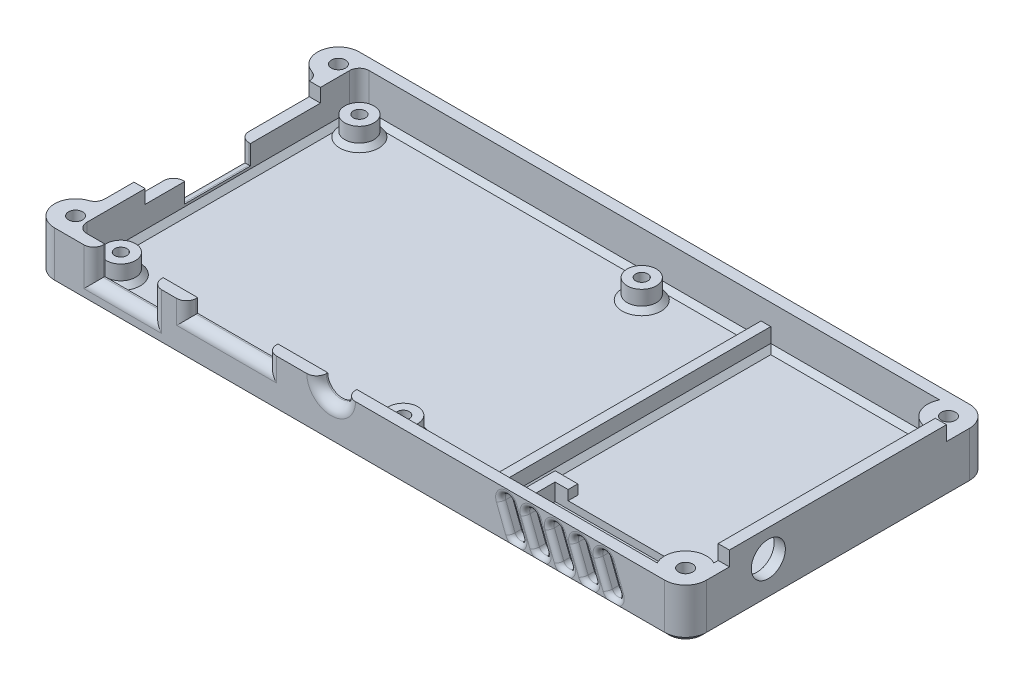
from build123d import *

# Parameters (mm, degrees)
SKETCH3_W                      = 129.6
SKETCH3_H                      = 62.6
SKETCH3_W_2                    = 125
SKETCH3_H_2                    = 58
BOSS_EXTRUDE1_DEPTH            = 10.3
SKETCH5_W                      = 125
SKETCH5_H                      = 58
BOSS_EXTRUDE2_DEPTH            = 2
SKETCH6_R                      = 3
BOSS_EXTRUDE3_DEPTH            = 4
F_2_5_2_5_DIAMETER_HOLE1_D     = 2.5
F_2_5_2_5_DIAMETER_HOLE1_DEPTH = 8
F_2_5_2_5_DIAMETER_HOLE1_TIP   = 0.751075774
SKETCH10_W                     = 2
SKETCH10_H                     = 58
BOSS_EXTRUDE4_DEPTH            = 4
CUT_EXTRUDE1_REACH             = 100.128
SKETCH11_R                     = 3
SKETCH11_W                     = 12
SKETCH11_H                     = 5.8
SKETCH11_W_2                   = 16.5
SKETCH11_H_2                   = 2.8
CUT_EXTRUDE2_REACH             = 136.484
SKETCH12_W                     = 13.5
SKETCH12_H                     = 6.8
SKETCH12_W_2                   = 36
SKETCH12_H_2                   = 2.8
FILLET6_R                      = 2
FILLET8_R                      = 2
CHAMFER1_SIZE                  = 1
FILLET9_R                      = 2
BOSS_EXTRUDE6_DEPTH            = 10.3
F_2_9_2_9_DIAMETER_HOLE2_D     = 2.9
F_2_9_2_9_DIAMETER_HOLE1_D     = 2.9
SKETCH24_R                     = 4.3
BOSS_EXTRUDE7_DEPTH            = 8.3
F_2_9_2_9_DIAMETER_HOLE5_D     = 2.9
F_2_9_2_9_DIAMETER_HOLE4_D     = 2.9
FILLET10_R                     = 4.3
FILLET18_R                     = 2
CHAMFER3_SIZE                  = 1
FILLET19_R                     = 2
FILLET20_R                     = 4.3
CHAMFER6_SIZE                  = 1
SKETCH29_W                     = 2.3
SKETCH29_H                     = 44.6
BOSS_EXTRUDE8_DEPTH            = 3
CUT_EXTRUDE3_REACH             = 163.516
SKETCH13_R                     = 3.5
SKETCH32_W                     = 30.1
SKETCH32_H                     = 10.2
CUT_EXTRUDE4_DEPTH             = 1.5
BOSS_EXTRUDE9_DEPTH            = 2
CUT_EXTRUDE5_REACH             = 103.795
FILLET21_R                     = 1
CHAMFER7_SIZE                  = 1


# Some blends are built 0.0001 mm under size
with BuildPart() as part:
    # Sketch3 → Boss-Extrude1 (new body)
    with BuildSketch(Plane(origin=(0, 0, 0), x_dir=(1, 0, 0), z_dir=(0, 1, 0))):
        with Locations((-10.061766162, 3.105993834)):
            Rectangle(SKETCH3_W, SKETCH3_H)
        with Locations((-10.061766162, 3.105993834)):
            Rectangle(SKETCH3_W_2, SKETCH3_H_2, mode=Mode.SUBTRACT)
    extrude(amount=BOSS_EXTRUDE1_DEPTH)

    # Sketch5 → Boss-Extrude2 (add)
    with BuildSketch(Plane(origin=(0, 0, 0), x_dir=(1, 0, 0), z_dir=(0, 1, 0))):
        with Locations((-10.061766162, 3.105993834)):
            Rectangle(SKETCH5_W, SKETCH5_H)
    extrude(amount=BOSS_EXTRUDE2_DEPTH)

    # Sketch6 → Boss-Extrude3 (add)
    with BuildSketch(Plane(origin=(0, 2, 0), x_dir=(1, 0, 0), z_dir=(0, 1, 0))):
        with Locations(Location((-68.061766162, 27.605993834, 0), (0, 0, 270))):
            Circle(SKETCH6_R)
        with Locations(Location((-68.061766162, -21.394006166, 0), (0, 0, 270))):
            Circle(SKETCH6_R)
        with Locations(Location((-10.061766162, -21.394006166, 0), (0, 0, 270))):
            Circle(SKETCH6_R)
        with Locations(Location((-10.061766162, 27.605993834, 0), (0, 0, 270))):
            Circle(SKETCH6_R)
    extrude(amount=BOSS_EXTRUDE3_DEPTH)

    # Ø2.5 (2.5) Diameter Hole1
    with Locations(Plane(origin=(0, 6, 0), x_dir=(1, 0, 0), z_dir=(0, 1, 0))):
        with Locations((-68.061766162, 27.605993834), (-10.061766162, 27.605993834), (-10.061766162, -21.394006166), (-68.061766162, -21.394006166)):
            Hole(F_2_5_2_5_DIAMETER_HOLE1_D / 2, depth=F_2_5_2_5_DIAMETER_HOLE1_DEPTH)
            with Locations((0, 0, -(F_2_5_2_5_DIAMETER_HOLE1_DEPTH + F_2_5_2_5_DIAMETER_HOLE1_TIP / 2))):  # 118° drill point
                Cone(0, F_2_5_2_5_DIAMETER_HOLE1_D / 2, F_2_5_2_5_DIAMETER_HOLE1_TIP, mode=Mode.SUBTRACT)

    # Sketch10 → Boss-Extrude4 (add)
    with BuildSketch(Plane(origin=(0, 2, 0), x_dir=(1, 0, 0), z_dir=(0, 1, 0))):
        with Locations((10.938233838, 3.105993834)):
            Rectangle(SKETCH10_W, SKETCH10_H)
    extrude(amount=BOSS_EXTRUDE4_DEPTH)

    # Sketch11 → Cut-Extrude1 (cut, up to next)
    with BuildSketch(Plane.XY.offset(28.194006166), mode=Mode.PRIVATE) as cut_extrude1_sk1:
        with Locations((-18.061766162, 10.3)):
            Circle(SKETCH11_R)
    cut_extrude1_tool1 = extrude(cut_extrude1_sk1.sketch, amount=-CUT_EXTRUDE1_REACH, mode=Mode.PRIVATE) & part.part
    # Sketch11 → Cut-Extrude1 (cut, up to next)
    with BuildSketch(Plane.XY.offset(28.194006166), mode=Mode.PRIVATE) as cut_extrude1_sk2:
        with Locations((-60.861766162, 7.4)):
            Rectangle(SKETCH11_W, SKETCH11_H)
    cut_extrude1_tool2 = extrude(cut_extrude1_sk2.sketch, amount=-CUT_EXTRUDE1_REACH, mode=Mode.PRIVATE) & part.part
    # Sketch11 → Cut-Extrude1 (cut, up to next)
    with BuildSketch(Plane.XY.offset(28.194006166), mode=Mode.PRIVATE) as cut_extrude1_sk3:
        with Locations((-39.527982648, 8.9)):
            Rectangle(SKETCH11_W_2, SKETCH11_H_2)
    cut_extrude1_tool3 = extrude(cut_extrude1_sk3.sketch, amount=-CUT_EXTRUDE1_REACH, mode=Mode.PRIVATE) & part.part
    add(cut_extrude1_tool1.solids().sort_by_distance((-18.061766, 10.3, 28.194006))[0], mode=Mode.SUBTRACT)
    add(cut_extrude1_tool2.solids().sort_by_distance((-60.861766, 7.4, 28.194006))[0], mode=Mode.SUBTRACT)
    add(cut_extrude1_tool3.solids().sort_by_distance((-39.527983, 8.9, 28.194006))[0], mode=Mode.SUBTRACT)

    # Sketch12 → Cut-Extrude2 (cut, up to next)
    with BuildSketch(Plane.ZY.offset(74.861766162), mode=Mode.PRIVATE) as cut_extrude2_sk1:
        with Locations((-2.982922372, 6.9)):
            Rectangle(SKETCH12_W, SKETCH12_H)
    cut_extrude2_tool1 = extrude(cut_extrude2_sk1.sketch, amount=-CUT_EXTRUDE2_REACH, mode=Mode.PRIVATE) & part.part
    # Sketch12 → Cut-Extrude2 (cut, up to next)
    with BuildSketch(Plane.ZY.offset(74.861766162), mode=Mode.PRIVATE) as cut_extrude2_sk2:
        with Locations((-6.105993834, 8.9)):
            Rectangle(SKETCH12_W_2, SKETCH12_H_2)
    cut_extrude2_tool2 = extrude(cut_extrude2_sk2.sketch, amount=-CUT_EXTRUDE2_REACH, mode=Mode.PRIVATE) & part.part
    add(cut_extrude2_tool1.solids().sort_by_distance((-74.861766, 6.9, -2.982922))[0], mode=Mode.SUBTRACT)
    add(cut_extrude2_tool2.solids().sort_by_distance((-74.861766, 8.9, -6.105994))[0], mode=Mode.SUBTRACT)

    # Fillet6
    fillet6_edges = [part.edges().sort_by_distance(p)[0] for p in [
        (52.438233838, 6.15, -32.105993834),
    ]]
    fillet(fillet6_edges, radius=FILLET6_R)

    # Fillet8
    fillet8_edges = [part.edges().sort_by_distance(p)[0] for p in [
        (-72.561766162, 6.15, -32.105993834),
        (-72.561766162, 6.15, 25.894006166),
    ]]
    fillet(fillet8_edges, radius=FILLET8_R)

    # Chamfer1
    chamfer1_edges = [part.edges().sort_by_distance(p)[0] for p in [
        (-68.061766162, 2, -30.605993834),
        (-68.061766162, 2, 18.394006166),
        (-10.061766162, 2, 18.394006166),
        (-10.061766162, 2, -30.605993834),
    ]]
    chamfer(chamfer1_edges, length=CHAMFER1_SIZE)

    # Fillet9
    fillet9_edges = [part.edges().sort_by_distance(p)[0] for p in [
        (-60.861766162, 4.5, 28.194006166),
        (-54.861766162, 7.4, 28.194006166),
        (-47.777982648, 8.9, 28.194006166),
        (-39.527982648, 7.5, 28.194006166),
        (-31.277982648, 8.9, 28.194006166),
        (-18.061766162, 7.3, 28.194006166),
        (-74.861766162, 5.5, -9.732922372),
        (-74.861766162, 3.5, -2.982922372),
        (-74.861766162, 5.5, 3.767077628),
    ]]
    fillet(fillet9_edges, radius=FILLET9_R)

    # Sketch17 → Boss-Extrude6 (add)
    with BuildSketch(Plane(origin=(0, 0, 0), x_dir=(1, 0, 0), z_dir=(0, 1, 0))):
        with BuildLine():
            Line((-74.861766162, 34.405993834), (-74.861766162, 25.805993834))
            ThreePointArc((-74.861766162, 25.805993834), (-79.161766162, 30.105993834), (-74.861766162, 34.405993834))
        make_face()
        with BuildLine():
            Line((-74.861766162, -19.594006166), (-74.861766162, -28.194006166))
            ThreePointArc((-74.861766162, -28.194006166), (-79.161766162, -23.894006166), (-74.861766162, -19.594006166))
        make_face()
    extrude(amount=BOSS_EXTRUDE6_DEPTH)

    # Ø2.9 (2.9) Diameter Hole2 (through all)
    with Locations(Plane(origin=(0, 10.3, 0), x_dir=(1, 0, 0), z_dir=(0, 1, 0))):
        with Locations((-74.861766162, 30.105993834)):
            Hole(F_2_9_2_9_DIAMETER_HOLE2_D / 2)

    # Ø2.9 (2.9) Diameter Hole1 (through all)
    with Locations(Plane(origin=(0, 10.3, 0), x_dir=(1, 0, 0), z_dir=(0, 1, 0))):
        with Locations((-74.861766162, -23.894006166)):
            Hole(F_2_9_2_9_DIAMETER_HOLE1_D / 2)

    # Sketch24 → Boss-Extrude7 (add)
    with BuildSketch(Plane(origin=(0, 2, 0), x_dir=(1, 0, 0), z_dir=(0, 1, 0))):
        with Locations((50.438233838, -23.894006166)):
            Circle(SKETCH24_R)
        with Locations((50.438233838, 30.105993834)):
            Circle(SKETCH24_R)
    extrude(amount=BOSS_EXTRUDE7_DEPTH)

    # Ø2.9 (2.9) Diameter Hole5 (through all)
    with Locations(Plane(origin=(0, 10.3, 0), x_dir=(1, 0, 0), z_dir=(0, 1, 0))):
        with Locations((50.438233838, -23.894006166)):
            Hole(F_2_9_2_9_DIAMETER_HOLE5_D / 2)

    # Ø2.9 (2.9) Diameter Hole4 (through all)
    with Locations(Plane(origin=(0, 10.3, 0), x_dir=(1, 0, 0), z_dir=(0, 1, 0))):
        with Locations((50.438233838, 30.105993834)):
            Hole(F_2_9_2_9_DIAMETER_HOLE4_D / 2)

    # Fillet10
    fillet10_edges = [part.edges().sort_by_distance(p)[0] for p in [
        (54.738233838, 5.15, -34.405993834),
    ]]
    fillet(fillet10_edges, radius=FILLET10_R - 0.0001)  # a hair under: the kernel refuses the full size

    # Fillet18
    fillet18_edges = [part.edges().sort_by_distance(p)[0] for p in [
        (-74.861766162, 5.15, -25.805993834),
        (-74.861766162, 5.15, 19.594006166),
    ]]
    fillet(fillet18_edges, radius=FILLET18_R)

    # Chamfer3
    chamfer3_edges = [part.edges().sort_by_distance(p)[0] for p in [
        (-79.105793795, 0, -30.797535193),
        (-12.211716162, 0, -34.405993834),
        (53.478822286, 0, -33.146582283),
        (-79.105793795, 0, 24.585547524),
        (-74.861766162, 0, -3.105993834),
        (-75.2385223, 0, 19.088261462),
        (-75.2385223, 0, -25.300249131),
        (54.738233838, 0, -0.956043834),
        (-10.061766162, 0, 28.194006166),
    ]]
    chamfer(chamfer3_edges, length=CHAMFER3_SIZE)

    # Fillet19
    fillet19_edges = [part.edges().sort_by_distance(p)[0] for p in [
        (-66.861766162, 6.4, 28.194006166),
    ]]
    fillet(fillet19_edges, radius=FILLET19_R)

    # Fillet20
    # the kernel refuses this fillet: 4.3 mm, written as the material it takes off along each edge
    with BuildSketch(Plane(origin=(54.738233838, -9.75, 28.194006166), x_dir=(-1, 0, 0), z_dir=(0, 1, 0))) as fillet20_piece_1:
        with BuildLine():
            CenterArc((FILLET20_R, -FILLET20_R), FILLET20_R, 90, 90)
            Line((0, -FILLET20_R), (0, 0))
            Line((0, 0), (FILLET20_R, 0))
        make_face()
    extrude(amount=30.8, mode=Mode.SUBTRACT)

    # Chamfer5
    # the kernel refuses this chamfer: 1 mm, written as the material it adds along each edge
    with BuildSketch(Plane(origin=(-72.561766162, 2, 23.894006166), x_dir=(-0.027495876610568366, 0.9996219169112972, 0), z_dir=(0, 0, -1))) as chamfer5_piece_1:
        with BuildLine():
            Line((1.028673195, 0), (-0.056547155, 1.027117794))
            Line((-0.056547155, 1.027117794), (-0.076539593, 1.026567876))
            ThreePointArc((-0.076539593, 1.026567876), (-0.034129227, 0.51339783), (-0.019992438, -0.000549918))
            Line((-0.019992438, -0.000549918), (0.000549918, -0.019992438))
            ThreePointArc((0.000549918, -0.019992438), (0.514497665, -0.00585565), (1.029223113, -0.019992438))
            Line((1.029223113, -0.019992438), (1.028673195, 0))
        make_face()
    extrude(amount=54)
    with BuildSketch(Plane(origin=(-70.561766162, 2, 23.894006166), x_dir=(0, 0, 1), z_dir=(1, 0, 0))) as chamfer5_piece_2:
        with BuildLine():
            Line((0.971715729, 0.028284271), (2.028284271, -1.028284271))
            Line((2.028284271, -1.028284271), (2.048284271, -1.028284271))
            ThreePointArc((2.048284271, -1.028284271), (2.02, -0.514142136), (2.02, 0))
            Line((2.02, 0), (2, 0.02))
            ThreePointArc((2, 0.02), (1.485857864, 0.02), (0.971715729, 0.048284271))
            Line((0.971715729, 0.048284271), (0.971715729, 0.028284271))
        make_face()
    revolve(axis=Axis((-70.561766162, 2, 23.894006166), (0, -1, 0)), revolution_arc=90)
    with BuildSketch(Plane(origin=(-70.561766162, 2, -30.105993834), x_dir=(0, 0, -1), z_dir=(1, 0, 0))) as chamfer5_piece_3:
        with BuildLine():
            Line((2.028284271, 1.028284271), (0.971715729, -0.028284271))
            Line((0.971715729, -0.028284271), (0.971715729, -0.048284271))
            ThreePointArc((0.971715729, -0.048284271), (1.485857864, -0.02), (2, -0.02))
            Line((2, -0.02), (2.02, 0))
            ThreePointArc((2.02, 0), (2.02, 0.514142136), (2.048284271, 1.028284271))
            Line((2.048284271, 1.028284271), (2.028284271, 1.028284271))
        make_face()
    revolve(axis=Axis((-70.561766162, 2, -30.105993834), (0, 1, 0)), revolution_arc=90)
    with BuildSketch(Plane(origin=(9.938233838, 2, 25.894006166), x_dir=(0, 0.9996219169112968, 0.027495876610585623), z_dir=(-1, 0, 0)), Plane(origin=(-70.561766162, 2, -32.105993834), x_dir=(0, 0.9996219169112968, -0.027495876610589075), z_dir=(1, 0, 0))) as chamfer5_piece_4:
        with BuildLine():
            Line((1.028673195, 0), (-0.056547155, 1.027117794))
            Line((-0.056547155, 1.027117794), (-0.076539593, 1.026567876))
            ThreePointArc((-0.076539593, 1.026567876), (-0.034129227, 0.51339783), (-0.019992438, -0.000549918))
            Line((-0.019992438, -0.000549918), (0.000549918, -0.019992438))
            ThreePointArc((0.000549918, -0.019992438), (0.514497665, -0.00585565), (1.029223113, -0.019992438))
            Line((1.029223113, -0.019992438), (1.028673195, 0))
        make_face()
    extrude(amount=80.5)
    with BuildSketch(Plane(origin=(9.938233838, 2, 25.894006166), x_dir=(0.027495876610585623, 0.9996219169112968, 0), z_dir=(0, 0, -1)), Plane(origin=(11.938233838, 2, -32.105993834), x_dir=(-0.027495876610585623, 0.9996219169112968, 0), z_dir=(0, 0, 1))) as chamfer5_piece_5:
        with BuildLine():
            Line((1.028673195, 0), (-0.056547155, -1.027117794))
            Line((-0.056547155, -1.027117794), (-0.076539593, -1.026567876))
            ThreePointArc((-0.076539593, -1.026567876), (-0.034129227, -0.51339783), (-0.019992438, 0.000549918))
            Line((-0.019992438, 0.000549918), (0.000549918, 0.019992438))
            ThreePointArc((0.000549918, 0.019992438), (0.514497665, 0.00585565), (1.029223113, 0.019992438))
            Line((1.029223113, 0.019992438), (1.028673195, 0))
        make_face()
    extrude(amount=58)
    with BuildSketch(Plane(origin=(11.938233838, 2, -32.105993834), x_dir=(0, 0.9996219169112968, -0.027495876610589075), z_dir=(1, 0, 0))) as chamfer5_piece_6_section:
        with BuildLine():
            Line((1.028673195, 0), (-0.056547155, 1.027117794))
            Line((-0.056547155, 1.027117794), (-0.076539593, 1.026567876))
            ThreePointArc((-0.076539593, 1.026567876), (-0.034129227, 0.51339783), (-0.019992438, -0.000549918))
            Line((-0.019992438, -0.000549918), (0.000549918, -0.019992438))
            ThreePointArc((0.000549918, -0.019992438), (0.514497665, -0.00585565), (1.029223113, -0.019992438))
            Line((1.029223113, -0.019992438), (1.028673195, 0))
        make_face()
    chamfer5_piece_6 = extrude(amount=37.265109726, mode=Mode.PRIVATE)
    chamfer5_piece_6 = chamfer5_piece_6 - Plane(origin=(50.438233838, 2.330190731, -30.105993834), x_dir=(1, 0, 0), z_dir=(0, -1, 0)) * Cylinder(4.3, 79, mode=Mode.PRIVATE)
    add(chamfer5_piece_6)
    with BuildSketch(Plane(origin=(9.938233838, 2, 28.465689154), x_dir=(0.027495876610585623, 0.9996219169112968, 0), z_dir=(0, 0, -1))) as chamfer5_piece_7a_section:
        with BuildLine():
            Line((1.028673195, 0), (-0.056547155, -1.027117794))
            Line((-0.056547155, -1.027117794), (-0.076539593, -1.026567876))
            ThreePointArc((-0.076539593, -1.026567876), (-0.034129227, -0.51339783), (-0.019992438, 0.000549918))
            Line((-0.019992438, 0.000549918), (0.000549918, 0.019992438))
            ThreePointArc((0.000549918, 0.019992438), (0.514497665, 0.00585565), (1.029223113, 0.019992438))
            Line((1.029223113, 0.019992438), (1.028673195, 0))
        make_face()
    chamfer5_piece_7a = extrude(amount=60.571682988, mode=Mode.PRIVATE)
    chamfer5_piece_7a = split(chamfer5_piece_7a, bisect_by=Plane(origin=(9.608440211, 2.329793627, 25.894006166), z_dir=(0, 0, 1)), keep=Keep.TOP, mode=Mode.PRIVATE)
    with BuildSketch(Plane(origin=(12.509916826, 2, 25.894006166), x_dir=(0, 0.9996219169112968, 0.027495876610585623), z_dir=(-1, 0, 0))) as chamfer5_piece_7b_section:
        with BuildLine():
            Line((1.028673195, 0), (-0.056547155, 1.027117794))
            Line((-0.056547155, 1.027117794), (-0.076539593, 1.026567876))
            ThreePointArc((-0.076539593, 1.026567876), (-0.034129227, 0.51339783), (-0.019992438, -0.000549918))
            Line((-0.019992438, -0.000549918), (0.000549918, -0.019992438))
            ThreePointArc((0.000549918, -0.019992438), (0.514497665, -0.00585565), (1.029223113, -0.019992438))
            Line((1.029223113, -0.019992438), (1.028673195, 0))
        make_face()
    chamfer5_piece_7b = extrude(amount=83.071682988, mode=Mode.PRIVATE)
    chamfer5_piece_7b = split(chamfer5_piece_7b, bisect_by=Plane(origin=(9.938233838, 2.329793627, 25.564212539), z_dir=(1, 0, 0)), keep=Keep.TOP, mode=Mode.PRIVATE)
    chamfer5_piece_7 = chamfer5_piece_7a & chamfer5_piece_7b
    add(chamfer5_piece_7)
    with BuildSketch(Plane(origin=(-70.561766162, 2, -32.105993834), x_dir=(0, 0.9996219169112968, -0.027495876610589075), z_dir=(1, 0, 0))) as chamfer5_piece_8a_section:
        with BuildLine():
            Line((1.028673195, 0), (-0.056547155, 1.027117794))
            Line((-0.056547155, 1.027117794), (-0.076539593, 1.026567876))
            ThreePointArc((-0.076539593, 1.026567876), (-0.034129227, 0.51339783), (-0.019992438, -0.000549918))
            Line((-0.019992438, -0.000549918), (0.000549918, -0.019992438))
            ThreePointArc((0.000549918, -0.019992438), (0.514497665, -0.00585565), (1.029223113, -0.019992438))
            Line((1.029223113, -0.019992438), (1.028673195, 0))
        make_face()
    chamfer5_piece_8a = extrude(amount=83.071682988, mode=Mode.PRIVATE)
    chamfer5_piece_8a = split(chamfer5_piece_8a, bisect_by=Plane(origin=(9.938233838, 2.329793627, -31.776200208), z_dir=(1, 0, 0)), keep=Keep.TOP, mode=Mode.PRIVATE)
    with BuildSketch(Plane(origin=(9.938233838, 2, 25.894006166), x_dir=(0.027495876610585623, 0.9996219169112968, 0), z_dir=(0, 0, -1))) as chamfer5_piece_8b_section:
        with BuildLine():
            Line((1.028673195, 0), (-0.056547155, -1.027117794))
            Line((-0.056547155, -1.027117794), (-0.076539593, -1.026567876))
            ThreePointArc((-0.076539593, -1.026567876), (-0.034129227, -0.51339783), (-0.019992438, 0.000549918))
            Line((-0.019992438, 0.000549918), (0.000549918, 0.019992438))
            ThreePointArc((0.000549918, 0.019992438), (0.514497665, 0.00585565), (1.029223113, 0.019992438))
            Line((1.029223113, 0.019992438), (1.028673195, 0))
        make_face()
    chamfer5_piece_8b = extrude(amount=60.571682988, mode=Mode.PRIVATE)
    chamfer5_piece_8b = split(chamfer5_piece_8b, bisect_by=Plane(origin=(9.608440211, 2.329793627, -32.105993834), z_dir=(0, 0, -1)), keep=Keep.TOP, mode=Mode.PRIVATE)
    chamfer5_piece_8 = chamfer5_piece_8a & chamfer5_piece_8b
    add(chamfer5_piece_8)
    with BuildSketch(Plane(origin=(9.36655085, 2, -32.105993834), x_dir=(0, 0.9996219169112968, -0.027495876610589075), z_dir=(1, 0, 0))) as chamfer5_piece_9a_section:
        with BuildLine():
            Line((1.028673195, 0), (-0.056547155, 1.027117794))
            Line((-0.056547155, 1.027117794), (-0.076539593, 1.026567876))
            ThreePointArc((-0.076539593, 1.026567876), (-0.034129227, 0.51339783), (-0.019992438, -0.000549918))
            Line((-0.019992438, -0.000549918), (0.000549918, -0.019992438))
            ThreePointArc((0.000549918, -0.019992438), (0.514497665, -0.00585565), (1.029223113, -0.019992438))
            Line((1.029223113, -0.019992438), (1.028673195, 0))
        make_face()
    chamfer5_piece_9a = extrude(amount=39.836792714, mode=Mode.PRIVATE)
    chamfer5_piece_9a = split(chamfer5_piece_9a, bisect_by=Plane(origin=(11.938233838, 2.329793627, -31.776200208), z_dir=(-1, 0, 0)), keep=Keep.TOP, mode=Mode.PRIVATE)
    with BuildSketch(Plane(origin=(11.938233838, 2, -34.677676822), x_dir=(-0.027495876610585623, 0.9996219169112968, 0), z_dir=(0, 0, 1))) as chamfer5_piece_9b_section:
        with BuildLine():
            Line((1.028673195, 0), (-0.056547155, -1.027117794))
            Line((-0.056547155, -1.027117794), (-0.076539593, -1.026567876))
            ThreePointArc((-0.076539593, -1.026567876), (-0.034129227, -0.51339783), (-0.019992438, 0.000549918))
            Line((-0.019992438, 0.000549918), (0.000549918, 0.019992438))
            ThreePointArc((0.000549918, 0.019992438), (0.514497665, 0.00585565), (1.029223113, 0.019992438))
            Line((1.029223113, 0.019992438), (1.028673195, 0))
        make_face()
    chamfer5_piece_9b = extrude(amount=60.571682988, mode=Mode.PRIVATE)
    chamfer5_piece_9b = split(chamfer5_piece_9b, bisect_by=Plane(origin=(12.268027465, 2.329793627, -32.105993834), z_dir=(0, 0, -1)), keep=Keep.TOP, mode=Mode.PRIVATE)
    chamfer5_piece_9 = chamfer5_piece_9a & chamfer5_piece_9b
    add(chamfer5_piece_9)

    # Chamfer6
    chamfer6_edges = [part.edges().sort_by_distance(p)[0] for p in [
        (52.438233838, 2, -3.105993834),
    ]]
    chamfer(chamfer6_edges, length=CHAMFER6_SIZE)

    # Sketch29 → Boss-Extrude8 (add)
    with BuildSketch(Plane(origin=(0, 10.3, 0), x_dir=(1, 0, 0), z_dir=(0, 1, 0))):
        with Locations((53.588233838, 3.105993834)):
            Rectangle(SKETCH29_W, SKETCH29_H)
    extrude(amount=BOSS_EXTRUDE8_DEPTH)

    # Sketch13 → Cut-Extrude3 (cut, up to next)
    with BuildSketch(Plane(origin=(54.738233838, 0, -61.144227672), x_dir=(0, 0, -1), z_dir=(1, 0, 0)), mode=Mode.PRIVATE) as cut_extrude3_sk1:
        with Locations((-72.338233838, 7.722271929)):
            Circle(SKETCH13_R)
    cut_extrude3_tool1 = extrude(cut_extrude3_sk1.sketch, amount=-CUT_EXTRUDE3_REACH, mode=Mode.PRIVATE) & part.part
    add(cut_extrude3_tool1.solids().sort_by_distance((54.738234, 7.722272, 11.194006))[0], mode=Mode.SUBTRACT)

    # Sketch32 → Cut-Extrude4 (cut)
    with BuildSketch(Plane(origin=(0, 2, 0), x_dir=(1, 0, 0), z_dir=(0, 1, 0))):
        with Locations((30.488233838, -20.794006166)):
            Rectangle(SKETCH32_W, SKETCH32_H)
    extrude(amount=-CUT_EXTRUDE4_DEPTH, mode=Mode.SUBTRACT)

    # Sketch33 → Boss-Extrude9 (add)
    with BuildSketch(Plane(origin=(0, 2, 0), x_dir=(1, 0, 0), z_dir=(0, 1, 0))):
        Polygon((15.438233838, -15.694006166), (15.438233838, -25.894006166), (13.438233838, -25.894006166), (13.438233838, -13.694006166), (18.108333222, -13.694006166), (18.108333222, -15.694006166), align=None)
        Polygon((47.538233838, -13.694006166), (47.538233838, -20.882174736), (45.538233838, -20.882174736), (45.538233838, -15.694006166), (42.868134454, -15.694006166), (42.868134454, -13.694006166), align=None)
    extrude(amount=BOSS_EXTRUDE9_DEPTH)

    # Sketch34 → Cut-Extrude5 (cut, up to next)
    with BuildSketch(Plane.XY.offset(28.194006166), mode=Mode.PRIVATE) as cut_extrude5_sk1:
        with BuildLine():
            Line((19.140183986, 8.196301764), (21.05650073, 3.254871795))
            ThreePointArc((21.05650073, 3.254871795), (20.34303063, 1.637478703), (18.725637537, 2.350948803))
            Line((18.725637537, 2.350948803), (16.809320793, 7.292378772))
            ThreePointArc((16.809320793, 7.292378772), (17.522790894, 8.909771864), (19.140183986, 8.196301764))
        make_face()
    cut_extrude5_tool1 = extrude(cut_extrude5_sk1.sketch, amount=-CUT_EXTRUDE5_REACH, mode=Mode.PRIVATE) & part.part
    # Sketch34 → Cut-Extrude5 (cut, up to next)
    with BuildSketch(Plane.XY.offset(28.194006166), mode=Mode.PRIVATE) as cut_extrude5_sk2:
        with BuildLine():
            Line((24.140183986, 8.196301764), (26.05650073, 3.254871795))
            ThreePointArc((26.05650073, 3.254871795), (25.34303063, 1.637478703), (23.725637537, 2.350948803))
            Line((23.725637537, 2.350948803), (21.809320793, 7.292378772))
            ThreePointArc((21.809320793, 7.292378772), (22.522790894, 8.909771864), (24.140183986, 8.196301764))
        make_face()
    cut_extrude5_tool2 = extrude(cut_extrude5_sk2.sketch, amount=-CUT_EXTRUDE5_REACH, mode=Mode.PRIVATE) & part.part
    # Sketch34 → Cut-Extrude5 (cut, up to next)
    with BuildSketch(Plane.XY.offset(28.194006166), mode=Mode.PRIVATE) as cut_extrude5_sk3:
        with BuildLine():
            Line((29.140183986, 8.196301764), (31.05650073, 3.254871795))
            ThreePointArc((31.05650073, 3.254871795), (30.34303063, 1.637478703), (28.725637537, 2.350948803))
            Line((28.725637537, 2.350948803), (26.809320793, 7.292378772))
            ThreePointArc((26.809320793, 7.292378772), (27.522790894, 8.909771864), (29.140183986, 8.196301764))
        make_face()
    cut_extrude5_tool3 = extrude(cut_extrude5_sk3.sketch, amount=-CUT_EXTRUDE5_REACH, mode=Mode.PRIVATE) & part.part
    # Sketch34 → Cut-Extrude5 (cut, up to next)
    with BuildSketch(Plane.XY.offset(28.194006166), mode=Mode.PRIVATE) as cut_extrude5_sk4:
        with BuildLine():
            Line((34.140183986, 8.196301764), (36.05650073, 3.254871795))
            ThreePointArc((36.05650073, 3.254871795), (35.34303063, 1.637478703), (33.725637537, 2.350948803))
            Line((33.725637537, 2.350948803), (31.809320793, 7.292378772))
            ThreePointArc((31.809320793, 7.292378772), (32.522790894, 8.909771864), (34.140183986, 8.196301764))
        make_face()
    cut_extrude5_tool4 = extrude(cut_extrude5_sk4.sketch, amount=-CUT_EXTRUDE5_REACH, mode=Mode.PRIVATE) & part.part
    # Sketch34 → Cut-Extrude5 (cut, up to next)
    with BuildSketch(Plane.XY.offset(28.194006166), mode=Mode.PRIVATE) as cut_extrude5_sk5:
        with BuildLine():
            Line((39.140183986, 8.196301764), (41.05650073, 3.254871795))
            ThreePointArc((41.05650073, 3.254871795), (40.34303063, 1.637478703), (38.725637537, 2.350948803))
            Line((38.725637537, 2.350948803), (36.809320793, 7.292378772))
            ThreePointArc((36.809320793, 7.292378772), (37.522790894, 8.909771864), (39.140183986, 8.196301764))
        make_face()
    cut_extrude5_tool5 = extrude(cut_extrude5_sk5.sketch, amount=-CUT_EXTRUDE5_REACH, mode=Mode.PRIVATE) & part.part
    add(cut_extrude5_tool1.solids().sort_by_distance((18.932911, 5.273625, 28.194006))[0], mode=Mode.SUBTRACT)
    add(cut_extrude5_tool2.solids().sort_by_distance((23.932911, 5.273625, 28.194006))[0], mode=Mode.SUBTRACT)
    add(cut_extrude5_tool3.solids().sort_by_distance((28.932911, 5.273625, 28.194006))[0], mode=Mode.SUBTRACT)
    add(cut_extrude5_tool4.solids().sort_by_distance((33.932911, 5.273625, 28.194006))[0], mode=Mode.SUBTRACT)
    add(cut_extrude5_tool5.solids().sort_by_distance((38.932911, 5.273625, 28.194006))[0], mode=Mode.SUBTRACT)

    # Fillet21
    # the kernel refuses this fillet: 1 mm, written as the material it takes off along each edge
    with BuildSketch(Plane(origin=(17.97475239, 7.744340268, 28.194006166), x_dir=(-0.9323452771444899, -0.3615691969545585, 0), z_dir=(0.3615691969545585, -0.9323452771444899, 0))) as fillet21_piece_1:
        with BuildLine():
            CenterArc((1.25 + FILLET21_R, FILLET21_R), FILLET21_R, 180, 90)
            Line((1.25 + FILLET21_R, 0), (1.25, 0))
            Line((1.25, 0), (1.25, FILLET21_R))
        make_face()
    revolve(axis=Axis((17.97475239, 7.744340268, 28.194006166), (0, 0, -1)), revolution_arc=180, mode=Mode.SUBTRACT)
    with BuildSketch(Plane(origin=(18.725637537, 2.350948803, 28.194006166), x_dir=(0, 0, -1), z_dir=(-0.36156919695456985, 0.9323452771444856, 0)), Plane(origin=(19.140183986, 8.196301764, 28.194006166), x_dir=(0, 0, -1), z_dir=(0.3615691969545619, -0.9323452771444886, 0)), Plane(origin=(23.725637537, 2.350948803, 28.194006166), x_dir=(0, 0, -1), z_dir=(-0.3615691969545605, 0.9323452771444891, 0)), Plane(origin=(24.140183986, 8.196301764, 28.194006166), x_dir=(0, 0, -1), z_dir=(0.3615691969545605, -0.9323452771444891, 0)), Plane(origin=(28.725637537, 2.350948803, 28.194006166), x_dir=(0, 0, -1), z_dir=(-0.3615691969545601, 0.9323452771444893, 0)), Plane(origin=(29.140183986, 8.196301764, 28.194006166), x_dir=(0, 0, -1), z_dir=(0.3615691969545628, -0.9323452771444882, 0)), Plane(origin=(33.725637537, 2.350948803, 28.194006166), x_dir=(0, 0, -1), z_dir=(-0.3615691969545628, 0.9323452771444882, 0)), Plane(origin=(34.140183986, 8.196301764, 28.194006166), x_dir=(0, 0, -1), z_dir=(0.3615691969545605, -0.9323452771444891, 0)), Plane(origin=(38.725637537, 2.350948803, 28.194006166), x_dir=(0, 0, -1), z_dir=(-0.3615691969545605, 0.9323452771444891, 0)), Plane(origin=(39.140183986, 8.196301764, 28.194006166), x_dir=(0, 0, -1), z_dir=(0.36156919695455964, -0.9323452771444896, 0))) as fillet21_piece_2:
        with BuildLine():
            CenterArc((FILLET21_R, FILLET21_R), FILLET21_R, 180, 90)
            Line((0, FILLET21_R), (0, 0))
            Line((0, 0), (FILLET21_R, 0))
        make_face()
    extrude(amount=5.3, mode=Mode.SUBTRACT)
    with BuildSketch(Plane(origin=(19.891069134, 2.802910299, 28.194006166), x_dir=(0.9323452771444968, 0.36156919695454104, 0), z_dir=(-0.36156919695454104, 0.9323452771444968, 0))) as fillet21_piece_3:
        with BuildLine():
            CenterArc((1.25 + FILLET21_R, FILLET21_R), FILLET21_R, 180, 90)
            Line((1.25 + FILLET21_R, 0), (1.25, 0))
            Line((1.25, 0), (1.25, FILLET21_R))
        make_face()
    revolve(axis=Axis((19.891069134, 2.802910299, 28.194006166), (0, 0, -1)), revolution_arc=180, mode=Mode.SUBTRACT)
    with BuildSketch(Plane(origin=(22.97475239, 7.744340268, 28.194006166), x_dir=(-0.9323452771444899, -0.3615691969545585, 0), z_dir=(0.3615691969545585, -0.9323452771444899, 0))) as fillet21_piece_4:
        with BuildLine():
            CenterArc((1.25 + FILLET21_R, FILLET21_R), FILLET21_R, 180, 90)
            Line((1.25 + FILLET21_R, 0), (1.25, 0))
            Line((1.25, 0), (1.25, FILLET21_R))
        make_face()
    revolve(axis=Axis((22.97475239, 7.744340268, 28.194006166), (0, 0, -1)), revolution_arc=180, mode=Mode.SUBTRACT)
    with BuildSketch(Plane(origin=(24.891069134, 2.802910299, 28.194006166), x_dir=(0.9323452771444884, 0.3615691969545626, 0), z_dir=(-0.3615691969545626, 0.9323452771444884, 0))) as fillet21_piece_5:
        with BuildLine():
            CenterArc((1.25 + FILLET21_R, FILLET21_R), FILLET21_R, 180, 90)
            Line((1.25 + FILLET21_R, 0), (1.25, 0))
            Line((1.25, 0), (1.25, FILLET21_R))
        make_face()
    revolve(axis=Axis((24.891069134, 2.802910299, 28.194006166), (0, 0, -1)), revolution_arc=180, mode=Mode.SUBTRACT)
    with BuildSketch(Plane(origin=(27.97475239, 7.744340268, 28.194006166), x_dir=(-0.9323452771444901, -0.36156919695455786, 0), z_dir=(0.36156919695455786, -0.9323452771444901, 0))) as fillet21_piece_6:
        with BuildLine():
            CenterArc((1.25 + FILLET21_R, FILLET21_R), FILLET21_R, 180, 90)
            Line((1.25 + FILLET21_R, 0), (1.25, 0))
            Line((1.25, 0), (1.25, FILLET21_R))
        make_face()
    revolve(axis=Axis((27.97475239, 7.744340268, 28.194006166), (0, 0, -1)), revolution_arc=180, mode=Mode.SUBTRACT)
    with BuildSketch(Plane(origin=(29.891069134, 2.802910299, 28.194006166), x_dir=(0.9323452771444861, 0.3615691969545684, 0), z_dir=(-0.3615691969545684, 0.9323452771444861, 0))) as fillet21_piece_7:
        with BuildLine():
            CenterArc((1.25 + FILLET21_R, FILLET21_R), FILLET21_R, 180, 90)
            Line((1.25 + FILLET21_R, 0), (1.25, 0))
            Line((1.25, 0), (1.25, FILLET21_R))
        make_face()
    revolve(axis=Axis((29.891069134, 2.802910299, 28.194006166), (0, 0, -1)), revolution_arc=180, mode=Mode.SUBTRACT)
    with BuildSketch(Plane(origin=(32.97475239, 7.744340268, 28.194006166), x_dir=(-0.9323452771444872, -0.36156919695456535, 0), z_dir=(0.36156919695456535, -0.9323452771444872, 0))) as fillet21_piece_8:
        with BuildLine():
            CenterArc((1.25 + FILLET21_R, FILLET21_R), FILLET21_R, 180, 90)
            Line((1.25 + FILLET21_R, 0), (1.25, 0))
            Line((1.25, 0), (1.25, FILLET21_R))
        make_face()
    revolve(axis=Axis((32.97475239, 7.744340268, 28.194006166), (0, 0, -1)), revolution_arc=180, mode=Mode.SUBTRACT)
    with BuildSketch(Plane(origin=(34.891069134, 2.802910299, 28.194006166), x_dir=(0.9323452771444815, 0.36156919695458034, 0), z_dir=(-0.36156919695458034, 0.9323452771444815, 0))) as fillet21_piece_9:
        with BuildLine():
            CenterArc((1.25 + FILLET21_R, FILLET21_R), FILLET21_R, 180, 90)
            Line((1.25 + FILLET21_R, 0), (1.25, 0))
            Line((1.25, 0), (1.25, FILLET21_R))
        make_face()
    revolve(axis=Axis((34.891069134, 2.802910299, 28.194006166), (0, 0, -1)), revolution_arc=180, mode=Mode.SUBTRACT)
    with BuildSketch(Plane(origin=(37.97475239, 7.744340268, 28.194006166), x_dir=(-0.9323452771444841, -0.3615691969545735, 0), z_dir=(0.3615691969545735, -0.9323452771444841, 0))) as fillet21_piece_10:
        with BuildLine():
            CenterArc((1.25 + FILLET21_R, FILLET21_R), FILLET21_R, 180, 90)
            Line((1.25 + FILLET21_R, 0), (1.25, 0))
            Line((1.25, 0), (1.25, FILLET21_R))
        make_face()
    revolve(axis=Axis((37.97475239, 7.744340268, 28.194006166), (0, 0, -1)), revolution_arc=180, mode=Mode.SUBTRACT)
    with BuildSketch(Plane(origin=(39.891069134, 2.802910299, 28.194006166), x_dir=(0.9323452771444932, 0.36156919695455003, 0), z_dir=(-0.36156919695455003, 0.9323452771444932, 0))) as fillet21_piece_11:
        with BuildLine():
            CenterArc((1.25 + FILLET21_R, FILLET21_R), FILLET21_R, 180, 90)
            Line((1.25 + FILLET21_R, 0), (1.25, 0))
            Line((1.25, 0), (1.25, FILLET21_R))
        make_face()
    revolve(axis=Axis((39.891069134, 2.802910299, 28.194006166), (0, 0, -1)), revolution_arc=180, mode=Mode.SUBTRACT)

    # Chamfer7
    chamfer7_edges = [part.edges().sort_by_distance(p)[0] for p in [
        (53.478792997, 0, 26.934565325),
    ]]
    chamfer(chamfer7_edges, length=CHAMFER7_SIZE - 0.0001)  # a hair under: the kernel refuses the full size


solid = part.part
